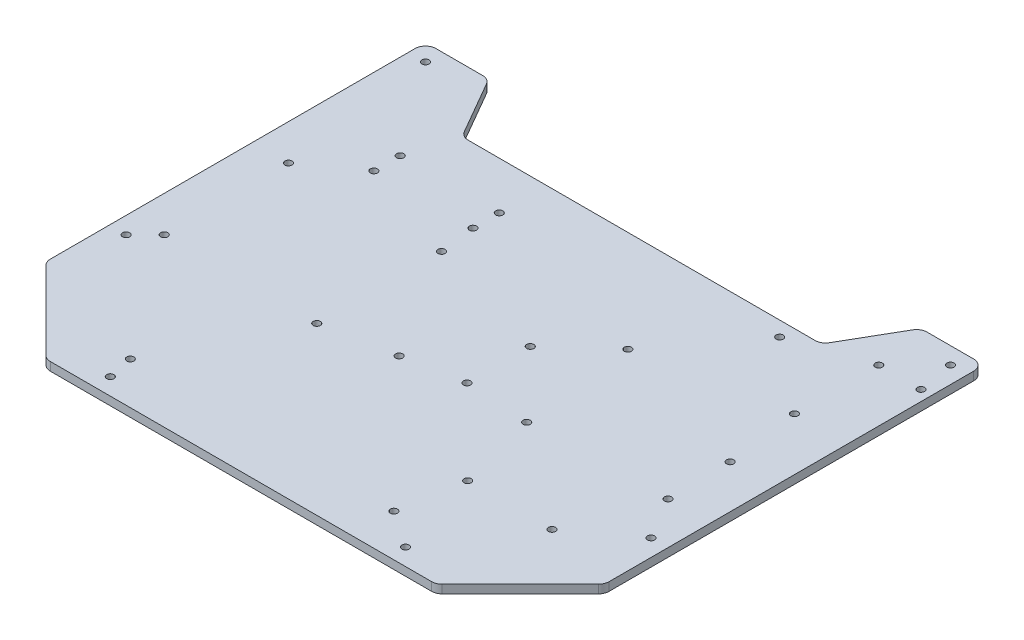
from build123d import *

# Parameters (mm, degrees)
MAIN_EXTRUSION_DEPTH    = 4
CONG_1_R                = 5
ESQUISSE1_R             = 1
ENL_V_MAT_EXTRU_1_DEPTH = 257.850637531
D_GAGEMENT_M31_D        = 3.4
ESQUISSE4_R             = 1
ENL_V_MAT_EXTRU_2_DEPTH = 257.850637531
D_GAGEMENT_M32_D        = 3.4


with BuildPart() as part:
    # Main scetch → Main extrusion (new body)
    with BuildSketch(Plane(origin=(0, 0, 0), x_dir=(1, 0, 0), z_dir=(0, 1, 0))):
        Polygon((-92.5, 0), (92.5, 0), (132.5, 40), (132.5, 220), (102.5, 220), (85.179491924, 190), (-85.179491924, 190), (-102.5, 220), (-132.5, 220), (-132.5, 40), align=None)
    extrude(amount=MAIN_EXTRUSION_DEPTH)

    # Congé1
    cong_1_edges = [part.edges().sort_by_distance(p)[0] for p in [
        (-132.5, 2, -40),
        (-92.5, 2, 0),
        (92.5, 2, 0),
        (132.5, 2, -40),
        (132.5, 2, -220),
        (102.5, 2, -220),
        (85.179491924, 2, -190),
        (-85.179491924, 2, -190),
        (-102.5, 2, -220),
        (-132.5, 2, -220),
    ]]
    fillet(cong_1_edges, radius=CONG_1_R)

    # Esquisse1 → Enlèv. mat.-Extru.1 (cut, through all)
    with BuildSketch(Plane(origin=(0, 4, 0), x_dir=(1, 0, 0), z_dir=(0, 1, 0))):
        with Locations((70, 8)):
            Circle(ESQUISSE1_R)
        with Locations((124.5, 70)):
            Circle(ESQUISSE1_R)
        with Locations((124.5, 212)):
            Circle(ESQUISSE1_R)
        with Locations((-124.5, 212)):
            Circle(ESQUISSE1_R)
        with Locations((-124.5, 70)):
            Circle(ESQUISSE1_R)
        with Locations((-70, 8)):
            Circle(ESQUISSE1_R)
    extrude(amount=-ENL_V_MAT_EXTRU_1_DEPTH, mode=Mode.SUBTRACT)

    # Dégagement M31 (through all)
    with Locations(Plane(origin=(0, 4, 0), x_dir=(1, 0, 0), z_dir=(0, 1, 0))):
        with Locations((-124.5, 212), (-124.5, 70), (-70, 8), (70, 8), (124.5, 70), (124.5, 212)):
            Hole(D_GAGEMENT_M31_D / 2)

    # Esquisse4 → Enlèv. mat.-Extru.2 (cut, through all)
    with BuildSketch(Plane(origin=(0, 4, 0), x_dir=(1, 0, 0), z_dir=(0, 1, 0))):
        with Locations((72.5, 183)):
            Circle(ESQUISSE4_R)
        with Locations((41.5, 142)):
            Circle(ESQUISSE4_R)
        with Locations((107.5, 155)):
            Circle(ESQUISSE4_R)
        with Locations((127.5, 195)):
            Circle(ESQUISSE4_R)
        with Locations((112, 120)):
            Circle(ESQUISSE4_R)
        with Locations((112.5, 90)):
            Circle(ESQUISSE4_R)
        with Locations((17.2, 120)):
            Circle(ESQUISSE4_R)
        with Locations((17.2, 90)):
            Circle(ESQUISSE4_R)
        with Locations((47.5, 88)):
            Circle(ESQUISSE4_R)
        with Locations((57.5, 50)):
            Circle(ESQUISSE4_R)
        with Locations((97.5, 50)):
            Circle(ESQUISSE4_R)
        with Locations((52.5, 20)):
            Circle(ESQUISSE4_R)
        with Locations((-10, 85)):
            Circle(ESQUISSE4_R)
        with Locations((-72.5, 20)):
            Circle(ESQUISSE4_R)
        with Locations((107.5, 195)):
            Circle(ESQUISSE4_R)
        with Locations((-115.5, 138)):
            Circle(ESQUISSE4_R)
        with Locations((-42.86, 138)):
            Circle(ESQUISSE4_R)
        with Locations((-115.5, 79.07)):
            Circle(ESQUISSE4_R)
        with Locations((-42.890430383, 78.82)):
            Circle(ESQUISSE4_R)
        with Locations((-92, 167.5)):
            Circle(ESQUISSE4_R)
        with Locations((-45, 167.5)):
            Circle(ESQUISSE4_R)
        with Locations((-92, 155)):
            Circle(ESQUISSE4_R)
        with Locations((-45, 155)):
            Circle(ESQUISSE4_R)
    extrude(amount=-ENL_V_MAT_EXTRU_2_DEPTH, mode=Mode.SUBTRACT)

    # Dégagement M32 (through all)
    with Locations(Plane(origin=(0, 4, 0), x_dir=(1, 0, 0), z_dir=(0, 1, 0))):
        with Locations((17.2, 120), (41.5, 142), (72.5, 183), (107.5, 155), (127.5, 195), (112, 120), (112.5, 90), (47.5, 88), (17.2, 90), (57.5, 50), (97.5, 50), (-10, 85), (-72.5, 20), (52.5, 20), (107.5, 195), (-115.5, 138), (-42.86, 138), (-115.5, 79.07), (-42.890430383, 78.82), (-92, 167.5), (-92, 155), (-45, 155), (-45, 167.5)):
            Hole(D_GAGEMENT_M32_D / 2)


solid = part.part
